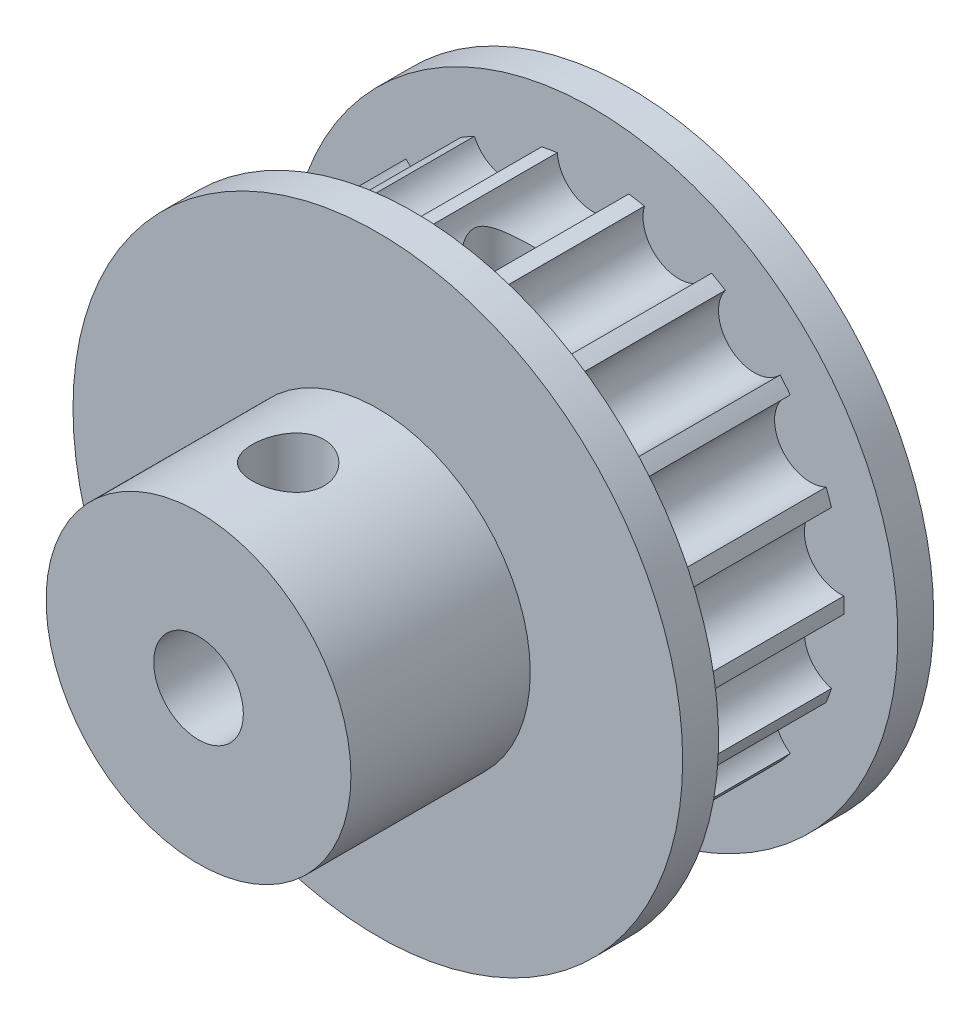
from build123d import *

# Parameters (mm, degrees)
SKETCH1_R                 = 17
BOSS_EXTRUDE1_DEPTH       = 14
CUT_EXTRUDE2_REACH        = 29.821
SKETCH3_R                 = 2.5
BOSS_EXTRUDE2_START       = 10
SKETCH5_R                 = 8.5
SKETCH5_R_2               = 2.5
BOSS_EXTRUDE2_DEPTH       = 10
SKETCH7_R                 = 17
SKETCH7_R_2               = 14
CUT_EXTRUDE5_DEPTH        = 5
SKETCH8_R                 = 2
CUT_EXTRUDE6_DEPTH        = 5
SKETCH9_R                 = 2
CUT_EXTRUDE7_DEPTH        = 10
M4_TAPPED_HOLE2_OUTLINE_W = 1.65
M4_TAPPED_HOLE2_OUTLINE_H = 10.992017373


with BuildPart() as part:
    # Sketch1 → Boss-Extrude1 (new body)
    with BuildSketch(Plane.XY):
        Circle(SKETCH1_R)
    extrude(amount=BOSS_EXTRUDE1_DEPTH)

    # Sketch3 → Cut-Extrude2 (cut, up to next)
    with BuildSketch(Plane.XY.offset(14), mode=Mode.PRIVATE) as cut_extrude2_sk1:
        Circle(SKETCH3_R)
    cut_extrude2_tool1 = extrude(cut_extrude2_sk1.sketch, amount=-CUT_EXTRUDE2_REACH, mode=Mode.PRIVATE) & part.part
    add(cut_extrude2_tool1.solids().sort_by_distance((0, 0, 14))[0], mode=Mode.SUBTRACT)

    # Sketch5 → Boss-Extrude2 (add)
    with BuildSketch(Plane.XY.offset(14).offset(BOSS_EXTRUDE2_START)):
        Circle(SKETCH5_R)
        Circle(SKETCH5_R_2, mode=Mode.SUBTRACT)
    extrude(amount=-BOSS_EXTRUDE2_DEPTH)

    # Sketch7 → Cut-Extrude5 (cut, symmetric)
    with BuildSketch(Plane(origin=(0, 0, 7), x_dir=(-1, 0, 0), z_dir=(0, 0, -1))):
        Circle(SKETCH7_R)
        Circle(SKETCH7_R_2, mode=Mode.SUBTRACT)
    extrude(amount=CUT_EXTRUDE5_DEPTH, both=True, mode=Mode.SUBTRACT)

    # Sketch8 → Cut-Extrude6 (cut, symmetric)
    with BuildSketch(Plane(origin=(0, 0, 7), x_dir=(-1, 0, 0), z_dir=(0, 0, -1))):
        with Locations((0, 14)):
            Circle(SKETCH8_R)
        with Locations((4.788282007, 13.155696691)):
            Circle(SKETCH8_R)
        with Locations((8.999026536, 10.724622204)):
            Circle(SKETCH8_R)
        with Locations((12.124355653, 7)):
            Circle(SKETCH8_R)
        with Locations((13.787308542, 2.431074487)):
            Circle(SKETCH8_R)
        with Locations((13.787308542, -2.431074487)):
            Circle(SKETCH8_R)
        with Locations((12.124355653, -7)):
            Circle(SKETCH8_R)
        with Locations((8.999026536, -10.724622204)):
            Circle(SKETCH8_R)
        with Locations((4.788282007, -13.155696691)):
            Circle(SKETCH8_R)
        with Locations((0, -14)):
            Circle(SKETCH8_R)
        with Locations((-4.788282007, -13.155696691)):
            Circle(SKETCH8_R)
        with Locations((-8.999026536, -10.724622204)):
            Circle(SKETCH8_R)
        with Locations((-12.124355653, -7)):
            Circle(SKETCH8_R)
        with Locations((-13.787308542, -2.431074487)):
            Circle(SKETCH8_R)
        with Locations((-13.787308542, 2.431074487)):
            Circle(SKETCH8_R)
        with Locations((-12.124355653, 7)):
            Circle(SKETCH8_R)
        with Locations((-8.999026536, 10.724622204)):
            Circle(SKETCH8_R)
        with Locations((-4.788282007, 13.155696691)):
            Circle(SKETCH8_R)
    extrude(amount=CUT_EXTRUDE6_DEPTH, both=True, mode=Mode.SUBTRACT)

    # Sketch9 → Cut-Extrude7 (cut)
    with BuildSketch(Plane(origin=(0, 0, 0), x_dir=(1, 0, 0), z_dir=(0, 1, 0))):
        with Locations(Location((0, -19, 0), (0, 0, 90))):
            Circle(SKETCH9_R)
    extrude(amount=CUT_EXTRUDE7_DEPTH, mode=Mode.SUBTRACT)

    # M4 Tapped Hole2: read off the stored shape, not the designer's step
    # M4 Tapped Hole2 outline → M4 Tapped Hole2 (revolve, cut)
    with BuildSketch(Plane.XY.offset(7)):
        with Locations((0.825, 7.373848872)):
            Rectangle(M4_TAPPED_HOLE2_OUTLINE_W, M4_TAPPED_HOLE2_OUTLINE_H)
    revolve(axis=Axis((0, 0, 7), (0, 1, 0)), mode=Mode.SUBTRACT)


solid = part.part
